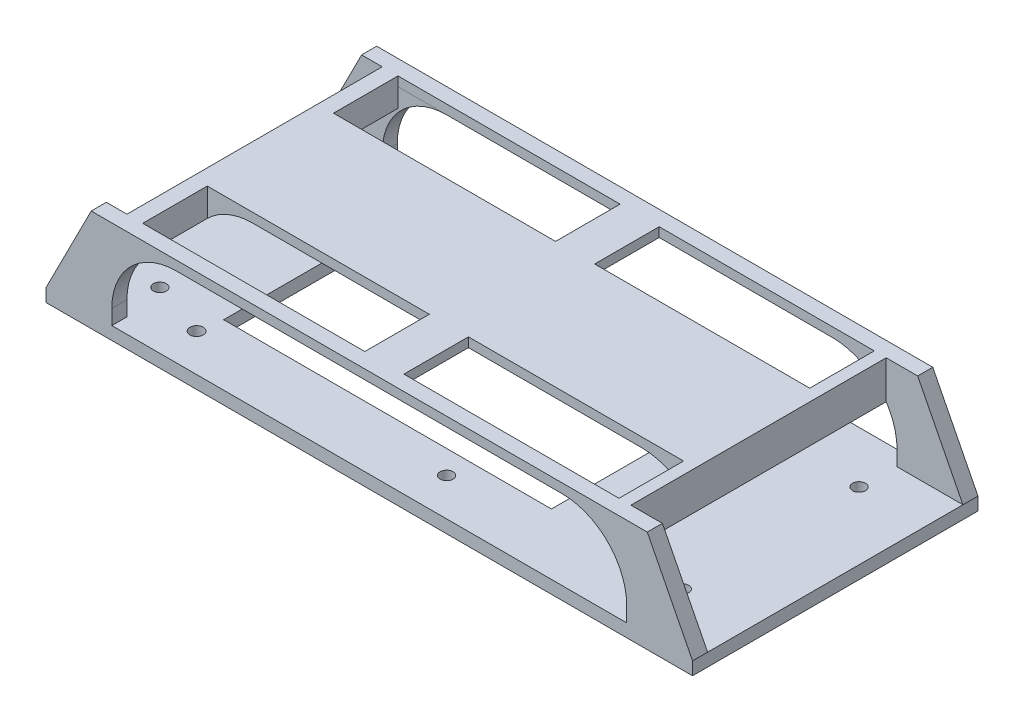
from build123d import *

# Parameters (mm, degrees)
SKETCH_1_W               = 150
SKETCH_1_H               = 100
EXTRUDE_1_DEPTH          = 3
CUT_EXTRUDE_1_DEPTH      = 10
SKETCH_4_R               = 1.5
CUT_EXTRUDE_2_DEPTH      = 10
CUT_EXTRUDE_3_DEPTH      = 10
EXTRUDE_2_REACH          = 102.102
CUT_EXTRUDE_4_DEPTH      = 214
CUT_EXTRUDE_4_DEPTH_BACK = 24
SKETCH_8_W               = 26.114706757
SKETCH_8_H               = 20.636533531
SKETCH_11_R              = 1.55
SKETCH_11_R_2            = 1.5
CUT_EXTRUDE_5_DEPTH      = 27
EXTRUDE_START            = -66.229414
SKETCH_12_W              = 119.453449028
SKETCH_12_H              = 2.174025896
EXTRUDE_3_DEPTH          = 66.229414
EXTRUDE_START_2          = -2.174026
SKETCH_13_W              = 4.778137961
SKETCH_13_H              = 26.114706757
EXTRUDE_4_DEPTH          = 2.174026
CUT_EXTRUDE_6_DEPTH      = 2.174025896
CUT_EXTRUDE_8_DEPTH      = 7
SKETCH_18_W              = 4.778137961
SKETCH_18_H              = 2.174025896
CUT_EXTRUDE_9_DEPTH      = 29.282146497
SKETCH_19_W              = 3.665528499
SKETCH_19_H              = 2.174025896
EXTRUDE_7_DEPTH          = 59.229414
SKETCH_20_W              = 2.762304407
SKETCH_20_H              = 14.973633508
EXTRUDE_8_DEPTH          = 2.174025896
SKETCH_21_W              = 4.846380184
SKETCH_21_H              = 29.282146498
CUT_EXTRUDE_10_DEPTH     = 2.174025896
FILLET_3_R               = 15
SKETCH_22_W              = 3.665528499
SKETCH_22_H              = 4.33713538
EXTRUDE_9_DEPTH          = 59.229413514
FILLET_4_R               = 15
SKETCH_23_W              = 76.043557339
SKETCH_23_H              = 38.123441179
CUT_EXTRUDE_11_DEPTH     = 8


with BuildPart() as part:
    # 草图1 → 凸台-拉伸1 (new body)
    with BuildSketch(Plane(origin=(0, 0, 0), x_dir=(1, 0, 0), z_dir=(0, 1, 0))):
        Rectangle(SKETCH_1_W, SKETCH_1_H)
    extrude(amount=EXTRUDE_1_DEPTH)

    # 草图2 → 切除-拉伸1 (cut)
    with BuildSketch(Plane(origin=(0, 3, 0), x_dir=(1, 0, 0), z_dir=(0, 1, 0))):
        Polygon((-75, 25.450950707), (82.438645769, 25.450950707), (82.438645769, 50), (45.243784289, 69.01769232), (-35.190103662, 62.508591561), (-89.149345597, 58.141947705), align=None)
    extrude(amount=-CUT_EXTRUDE_1_DEPTH, mode=Mode.SUBTRACT)

    # 草图4 → 切除-拉伸2 (cut)
    with BuildSketch(Plane(origin=(0, 3, 0), x_dir=(1, 0, 0), z_dir=(0, 1, 0))):
        with Locations(Location((59.370364421, 4.256376577, 0), (0, 0, 270))):
            Circle(SKETCH_4_R)
        with Locations(Location((59.370364421, -36.743623423, 0), (0, 0, 270))):
            Circle(SKETCH_4_R)
        with Locations(Location((-61.837405042, -36.743623423, 0), (0, 0, 270))):
            Circle(SKETCH_4_R)
        with Locations(Location((-61.837405042, 4.256376577, 0), (0, 0, 270))):
            Circle(SKETCH_4_R)
    extrude(amount=-CUT_EXTRUDE_2_DEPTH, mode=Mode.SUBTRACT)

    # 草图5 → 切除-拉伸3 (cut)
    with BuildSketch(Plane(origin=(0, 3, 0), x_dir=(1, 0, 0), z_dir=(0, 1, 0))):
        Polygon((-75, 16.229413514), (82.270873699, 16.229413514), (82.270873699, 33.668010185), (-81.615992849, 33.668010185), (-81.615992849, 16.229413514), align=None)
    extrude(amount=-CUT_EXTRUDE_3_DEPTH, mode=Mode.SUBTRACT)

    # 凸台-拉伸2: up to this face of the body (flat: up to its plane)
    extrude_2_end = Plane(part.part.faces().sort_by_distance((0, 1.5, -16.229413514))[0])
    # 草图6 → 凸台-拉伸2 (add, up to the picked face)
    with BuildSketch(Plane.XY.offset(50), mode=Mode.PRIVATE) as extrude_2_sk1:
        Polygon((-75, 3), (-64.504862475, 23.636533531), (-59.726724514, 23.636533531), (-59.726724514, 3), align=None)
    extrude_2_tool1 = split(extrude(extrude_2_sk1.sketch, amount=-EXTRUDE_2_REACH, mode=Mode.PRIVATE), bisect_by=extrude_2_end, keep=Keep.BOTH, mode=Mode.PRIVATE)
    # 草图6 → 凸台-拉伸2 (add, up to the picked face)
    with BuildSketch(Plane.XY.offset(50), mode=Mode.PRIVATE) as extrude_2_sk2:
        Polygon((59.726724514, 23.636533531), (59.726724514, 3), (75, 3), (64.504862475, 23.636533531), align=None)
    extrude_2_tool2 = split(extrude(extrude_2_sk2.sketch, amount=-EXTRUDE_2_REACH, mode=Mode.PRIVATE), bisect_by=extrude_2_end, keep=Keep.BOTH, mode=Mode.PRIVATE)
    add(extrude_2_tool1.solids().sort_by(Axis((-65.197351, 11.518034, 50), (0, 0, -1)))[0])
    add(extrude_2_tool2.solids().sort_by(Axis((65.197351, 11.518034, 50), (0, 0, -1)))[0])

    # 草图8 → 切除-拉伸4 (cut, two sides: drawn at the far end of the back side and taken through both)
    with BuildSketch(Plane.ZY.offset(-59.726724514).offset(-CUT_EXTRUDE_4_DEPTH_BACK)):
        with Locations((0.327939865, 13.318266766)):
            Rectangle(SKETCH_8_W, SKETCH_8_H)
        with Locations((33.442646622, 13.318266766)):
            Rectangle(SKETCH_8_W, SKETCH_8_H)
    extrude(amount=CUT_EXTRUDE_4_DEPTH + CUT_EXTRUDE_4_DEPTH_BACK, mode=Mode.SUBTRACT)

    # 草图11 → 切除-拉伸5 (cut)
    with BuildSketch(Plane.XZ):
        with Locations(Location((-48.790619751, 41.270586486, 0), (0, 0, 270))):
            Circle(SKETCH_11_R)
        with Locations(Location((9.209380249, 41.270586486, 0), (0, 0, 270))):
            Circle(SKETCH_11_R_2)
        with Locations(Location((-48.790619751, -8.729413514, 0), (0, 0, 270))):
            Circle(SKETCH_11_R)
        with Locations(Location((9.209380249, -8.729413514, 0), (0, 0, 270))):
            Circle(SKETCH_11_R_2)
    extrude(amount=-CUT_EXTRUDE_5_DEPTH, mode=Mode.SUBTRACT)

    # 草图12 → 凸台-拉伸3 (add)
    with BuildSketch(Plane.XY.offset(50).offset(EXTRUDE_START)):
        with Locations((0, 22.549520583)):
            Rectangle(SKETCH_12_W, SKETCH_12_H)
    extrude(amount=EXTRUDE_3_DEPTH)

    # 草图13 → 凸台-拉伸4 (add)
    with BuildSketch(Plane(origin=(0, 23.636533531, 0), x_dir=(1, 0, 0), z_dir=(0, 1, 0)).offset(EXTRUDE_START_2)):
        with Locations((-62.115793495, -0.327939865)):
            Rectangle(SKETCH_13_W, SKETCH_13_H)
        with Locations((-62.115793495, -33.442646622)):
            Rectangle(SKETCH_13_W, SKETCH_13_H)
        with Locations((62.115793495, -33.442646622)):
            Rectangle(SKETCH_13_W, SKETCH_13_H)
        with Locations((62.115793495, -0.327939865)):
            Rectangle(SKETCH_13_W, SKETCH_13_H)
    extrude(amount=EXTRUDE_4_DEPTH)

    # 草图14 → 切除-拉伸6 (cut)
    with BuildSketch(Plane(origin=(0, 23.636533531, 0), x_dir=(1, 0, 0), z_dir=(0, 1, 0))):
        Polygon((-59.726724514, 12.729413514), (-4.537128548, 12.729413514), (-4.537128548, -2.244219994), (-64.504862475, -2.244219994), (-64.504862475, 12.729413514), align=None)
        Polygon((64.504862475, -2.244219994), (4.537128548, -2.244219994), (4.537128548, 12.729413514), (59.726724514, 12.729413514), (64.504862475, 12.729413514), align=None)
        Polygon((59.726724514, -46.5), (4.537128548, -46.5), (4.537128548, -31.526366492), (64.504862475, -31.526366492), (64.504862475, -46.5), align=None)
        Polygon((-64.504862475, -31.526366492), (-4.537128548, -31.526366492), (-4.537128548, -46.5), (-59.726724514, -46.5), (-64.504862475, -46.5), align=None)
    extrude(amount=-CUT_EXTRUDE_6_DEPTH, mode=Mode.SUBTRACT)

    # 草图16 → 切除-拉伸8 (cut)
    with BuildSketch(Plane.XY.offset(20.385293243)):
        Polygon((-64.504862475, 23.636533531), (-75, 3), (-59.726724514, 3), (-59.726724514, 23.636533531), align=None)
        Polygon((59.726724514, 23.636533531), (64.504862475, 23.636533531), (75, 3), (59.726724514, 3), align=None)
    extrude(amount=-CUT_EXTRUDE_8_DEPTH, mode=Mode.SUBTRACT)

    # 草图18 → 切除-拉伸9 (cut)
    with BuildSketch(Plane.XY.offset(31.526366492)):
        with Locations((-62.115793495, 22.549520583)):
            Rectangle(SKETCH_18_W, SKETCH_18_H)
        with Locations((62.115793495, 22.549520583)):
            Rectangle(SKETCH_18_W, SKETCH_18_H)
    extrude(amount=-CUT_EXTRUDE_9_DEPTH, mode=Mode.SUBTRACT)

    # 草图19 → 凸台-拉伸7 (add)
    with BuildSketch(Plane.XY.offset(-12.729413514)):
        with Locations((-57.893960265, 22.549520583)):
            Rectangle(SKETCH_19_W, SKETCH_19_H)
    extrude(amount=EXTRUDE_7_DEPTH)

    # 草图20 → 凸台-拉伸8 (add)
    with BuildSketch(Plane(origin=(0, 23.636533531, 0), x_dir=(1, 0, 0), z_dir=(0, 1, 0))):
        with Locations((55.818072582, 5.24259676)):
            Rectangle(SKETCH_20_W, SKETCH_20_H)
        with Locations((55.818072582, -39.013183246)):
            Rectangle(SKETCH_20_W, SKETCH_20_H)
    extrude(amount=-EXTRUDE_8_DEPTH)

    # 草图21 → 切除-拉伸10 (cut)
    with BuildSketch(Plane(origin=(0, 23.636533531, 0), x_dir=(1, 0, 0), z_dir=(0, 1, 0))):
        with Locations((59.622414877, -16.885293243)):
            Rectangle(SKETCH_21_W, SKETCH_21_H)
    extrude(amount=-CUT_EXTRUDE_10_DEPTH, mode=Mode.SUBTRACT)

    # 圆角3
    # the kernel refuses this fillet: 15 mm, written as the material it adds along each edge
    with BuildSketch(Plane(origin=(-59.726724514, 21.462507635, 9.000000486), x_dir=(1, 0, 0), z_dir=(0, 0, 1))) as fillet_3_piece_1_section:
        with BuildLine():
            CenterArc((FILLET_3_R, -FILLET_3_R), FILLET_3_R, 90, 90)
            Line((0, -FILLET_3_R), (0, 0))
            Line((0, 0), (FILLET_3_R, 0))
        make_face()
    fillet_3_piece_1 = extrude(amount=40.999999514, mode=Mode.PRIVATE)
    fillet_3_piece_1 = split(fillet_3_piece_1, bisect_by=Plane(origin=(-53.334627801, 19.96988212, 46.5), z_dir=(0, 0, 1)), keep=Keep.TOP, mode=Mode.PRIVATE)
    add(fillet_3_piece_1)
    with BuildSketch(Plane(origin=(-59.726724514, 21.462507635, -16.229413514), x_dir=(1, 0, 0), z_dir=(0, 0, 1))) as fillet_3_piece_2:
        with BuildLine():
            CenterArc((FILLET_3_R, -FILLET_3_R), FILLET_3_R, 90, 90)
            Line((0, -FILLET_3_R), (0, 0))
            Line((0, 0), (FILLET_3_R, 0))
        make_face()
    extrude(amount=3.5)
    with BuildSketch(Plane(origin=(59.726724514, 21.462507635, -16.229413514), x_dir=(-1, 0, 0), z_dir=(0, 0, 1)), Plane(origin=(59.726724514, 21.462507635, 46.5), x_dir=(-1, 0, 0), z_dir=(0, 0, 1))) as fillet_3_piece_3:
        with BuildLine():
            CenterArc((FILLET_3_R, FILLET_3_R), FILLET_3_R, 180, 90)
            Line((0, FILLET_3_R), (0, 0))
            Line((0, 0), (FILLET_3_R, 0))
        make_face()
    extrude(amount=3.5)
    with BuildSketch(Plane(origin=(59.726724514, 21.462507635, -16.229413514), x_dir=(-1, 0, 0), z_dir=(0, 0, 1))) as fillet_3_piece_4_section:
        with BuildLine():
            CenterArc((FILLET_3_R, FILLET_3_R), FILLET_3_R, 180, 90)
            Line((0, FILLET_3_R), (0, 0))
            Line((0, 0), (FILLET_3_R, 0))
        make_face()
    fillet_3_piece_4 = extrude(amount=41, mode=Mode.PRIVATE)
    fillet_3_piece_4 = split(fillet_3_piece_4, bisect_by=Plane(origin=(54.436920378, 18.896822282, -5.24259676), z_dir=(1, 0, 0)), keep=Keep.TOP, mode=Mode.PRIVATE)
    fillet_3_piece_4 = split(fillet_3_piece_4, bisect_by=Plane(origin=(57.199224785, 18.896822282, -5.24259676), z_dir=(-1, 0, 0)), keep=Keep.TOP, mode=Mode.PRIVATE)
    add(fillet_3_piece_4)
    with BuildSketch(Plane(origin=(59.726724514, 21.462507635, -53.729413514), x_dir=(-1, 0, 0), z_dir=(0, 0, 1))) as fillet_3_piece_5_section:
        with BuildLine():
            CenterArc((FILLET_3_R, FILLET_3_R), FILLET_3_R, 180, 90)
            Line((0, FILLET_3_R), (0, 0))
            Line((0, 0), (FILLET_3_R, 0))
        make_face()
    fillet_3_piece_5 = extrude(amount=78.5, mode=Mode.PRIVATE)
    fillet_3_piece_5 = split(fillet_3_piece_5, bisect_by=Plane(origin=(52.070892236, 20.41839557, 2.244219994), z_dir=(0, 0, 1)), keep=Keep.TOP, mode=Mode.PRIVATE)
    fillet_3_piece_5 = split(fillet_3_piece_5, bisect_by=Plane(origin=(57.199224785, 20.41839557, 13.50740324), z_dir=(-1, 0, 0)), keep=Keep.TOP, mode=Mode.PRIVATE)
    add(fillet_3_piece_5)
    with BuildSketch(Plane(origin=(59.726724514, 21.462507635, 9), x_dir=(-1, 0, 0), z_dir=(0, 0, 1))) as fillet_3_piece_6_section:
        with BuildLine():
            CenterArc((FILLET_3_R, FILLET_3_R), FILLET_3_R, 180, 90)
            Line((0, FILLET_3_R), (0, 0))
            Line((0, 0), (FILLET_3_R, 0))
        make_face()
    fillet_3_piece_6 = extrude(amount=78.5, mode=Mode.PRIVATE)
    fillet_3_piece_6 = split(fillet_3_piece_6, bisect_by=Plane(origin=(52.070892236, 20.41839557, 31.526366492), z_dir=(0, 0, -1)), keep=Keep.TOP, mode=Mode.PRIVATE)
    fillet_3_piece_6 = split(fillet_3_piece_6, bisect_by=Plane(origin=(57.199224785, 20.41839557, 20.263183246), z_dir=(-1, 0, 0)), keep=Keep.TOP, mode=Mode.PRIVATE)
    add(fillet_3_piece_6)
    with BuildSketch(Plane(origin=(59.726724514, 21.462507635, 9), x_dir=(-1, 0, 0), z_dir=(0, 0, 1))) as fillet_3_piece_7_section:
        with BuildLine():
            CenterArc((FILLET_3_R, FILLET_3_R), FILLET_3_R, 180, 90)
            Line((0, FILLET_3_R), (0, 0))
            Line((0, 0), (FILLET_3_R, 0))
        make_face()
    fillet_3_piece_7 = extrude(amount=41, mode=Mode.PRIVATE)
    fillet_3_piece_7 = split(fillet_3_piece_7, bisect_by=Plane(origin=(54.436920378, 18.896822282, 39.013183246), z_dir=(1, 0, 0)), keep=Keep.TOP, mode=Mode.PRIVATE)
    fillet_3_piece_7 = split(fillet_3_piece_7, bisect_by=Plane(origin=(57.199224785, 18.896822282, 39.013183246), z_dir=(-1, 0, 0)), keep=Keep.TOP, mode=Mode.PRIVATE)
    add(fillet_3_piece_7)

    # 草图22 → 凸台-拉伸9 (add)
    with BuildSketch(Plane.XY.offset(-12.729413514)):
        with Locations((-57.893960265, 19.293939945)):
            Rectangle(SKETCH_22_W, SKETCH_22_H)
    extrude(amount=EXTRUDE_9_DEPTH)

    # 圆角4
    # the kernel refuses this fillet: 15 mm, written as the material it adds along each edge
    with BuildSketch(Plane(origin=(-56.061196015, 21.462507635, 2.244219994), x_dir=(0, -1, 0), z_dir=(0, 0, 1))) as fillet_4_piece_1:
        with BuildLine():
            CenterArc((15, 10.550038772), FILLET_4_R, 180, 44.695261707)
            Line((0, 10.550038772), (-0.3, 10.550038772))
            Line((-0.3, 10.550038772), (-0.3, 0))
            Line((-0.3, 0), (0, -0.3))
            ThreePointArc((0, -0.3), (2.16856769, -0.3), (4.123878087, -0.211000775))
            Line((4.123878087, -0.211000775), (4.33713538, 0))
        make_face()
    extrude(amount=29.282146497)

    # 草图23 → 切除-拉伸11 (cut)
    with BuildSketch(Plane.XZ):
        with Locations((-9.912094706, 16.783630734)):
            Rectangle(SKETCH_23_W, SKETCH_23_H)
    extrude(amount=-CUT_EXTRUDE_11_DEPTH, mode=Mode.SUBTRACT)


solid = part.part
